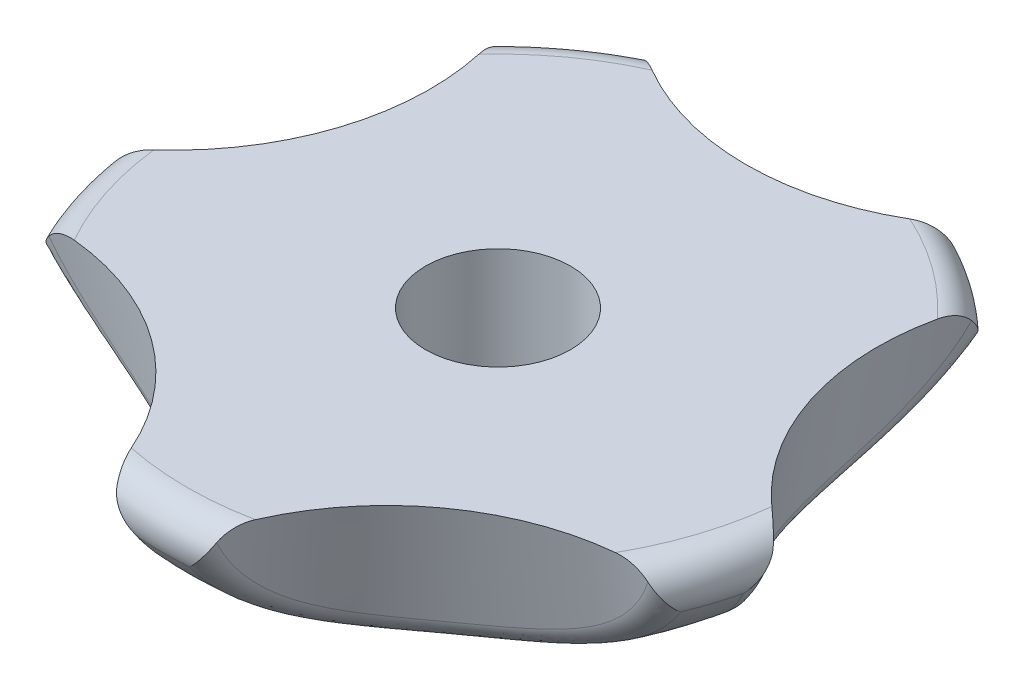
from build123d import *

# Parameters (mm, degrees)
ESQUISSE1_R                  = 12.5
ESQUISSE1_R_2                = 2.525
BOSS_EXTRU_1_DEPTH           = 5
CONG_7_R                     = 8
R_P_TITION_CIRCULAIRE1_COUNT = 5
ESQUISSE3_R                  = 5.083801513
ENL_V_MAT_EXTRU_2_DEPTH      = 1
ENL_V_MAT_EXTRU_2_DRAFT      = -45
CONG_9_R                     = 1


# Read off the part's stored shape, not the designer's step: Enlèv. mat.-Extru.1
with BuildPart() as part:
    # Esquisse1 → Boss.-Extru.1 (new body)
    with BuildSketch(Plane(origin=(0, 0, 0), x_dir=(1, 0, 0), z_dir=(0, 1, 0))):
        with Locations(Location((0, 0, 0), (0, 0, 270))):
            Circle(ESQUISSE1_R)
        with Locations(Location((0, 0, 0), (0, 0, 270))):
            Circle(ESQUISSE1_R_2, mode=Mode.SUBTRACT)
    extrude(amount=BOSS_EXTRU_1_DEPTH)

    # Congé7
    # the kernel refuses this fillet: 8 mm, written as the material it takes off along each edge
    with BuildSketch(Plane(origin=(0, 0, 0), x_dir=(0, 0, 1), z_dir=(-1, 0, 0))) as cong_7_piece_1:
        with BuildLine():
            CenterArc((5.083801513, 8), CONG_7_R, 270, 67.975687163)
            Line((5.083801513, 0), (5.083801513, -0.16))
            Line((5.083801513, -0.16), (12.5, -0.16))
            Line((12.5, -0.16), (12.66, 0))
            ThreePointArc((12.66, 0), (12.66, 2.5), (12.64832397, 4.94))
            Line((12.64832397, 4.94), (12.5, 5))
        make_face()
    revolve(axis=Axis((0, 0, 0), (0, 1, 0)), mode=Mode.SUBTRACT)

    # Enlèv. mat.-Extru.1 outline → Enlèv. mat.-Extru.1 (revolve, cut)
    with BuildSketch(Plane.XY.offset(-17.53859453)):
        Polygon((0, 0.491118968), (9.694525593, 0.491118968), (8.899488214, 5), (0, 5), align=None)
    enl_v_mat_extru_1 = revolve(axis=Axis((0, 0, -17.53859453), (0, 1, 0)), mode=Mode.SUBTRACT)

    # Répétition circulaire1: Enlèv. mat.-Extru.1 ×5 about axis
    r_p_tition_circulaire1_axis = Axis((0, 0, 0), (0, 1, 0))
    for i in range(1, R_P_TITION_CIRCULAIRE1_COUNT):
        add(enl_v_mat_extru_1.rotate(r_p_tition_circulaire1_axis, i * 360 / R_P_TITION_CIRCULAIRE1_COUNT), mode=Mode.SUBTRACT)


with BuildPart() as enl_v_mat_extru_2_tool:
    # Esquisse3 → Enlèv. mat.-Extru.2 (with draft: the straight prism first)
    with BuildSketch(Plane.XZ):
        Circle(ESQUISSE3_R)
    extrude(amount=-ENL_V_MAT_EXTRU_2_DEPTH)
    # Enlèv. mat.-Extru.2: the draft: its side faces are tilted about the plane it starts from
    enl_v_mat_extru_2_sides = [enl_v_mat_extru_2_tool.faces().sort_by_distance(p)[0] for p in [
        (-5.083801513, 0.5, 0),
    ]]
    draft(enl_v_mat_extru_2_sides, Plane.XZ, ENL_V_MAT_EXTRU_2_DRAFT)


with BuildPart() as part_1:
    add(part.part)

    # Enlèv. mat.-Extru.2: cut by enl_v_mat_extru_2_tool
    add(enl_v_mat_extru_2_tool.part, mode=Mode.SUBTRACT)

    # Congé9
    cong_9_edges = [part_1.edges().sort_by_distance(p)[0] for p in [
        (-7.347315654, 5, -10.11271243),
        (0, 0.491287765, -7.8440987),
        (-11.888206454, 5, 3.86271243),
        (-7.460181184, 0.491287765, -2.423959804),
        (0.797357133, 5, 12.474542942),
        (-4.610645534, 0.491287765, 6.346009154),
        (11.888206454, 5, 3.86271243),
        (4.610645534, 0.491287765, 6.346009154),
        (7.347315654, 5, -10.11271243),
        (7.460181184, 0.491287765, -2.423959804),
        (-3.594790524, 0, -3.594790524),
    ]]
    fillet(cong_9_edges, radius=CONG_9_R)


solid = part_1.part
